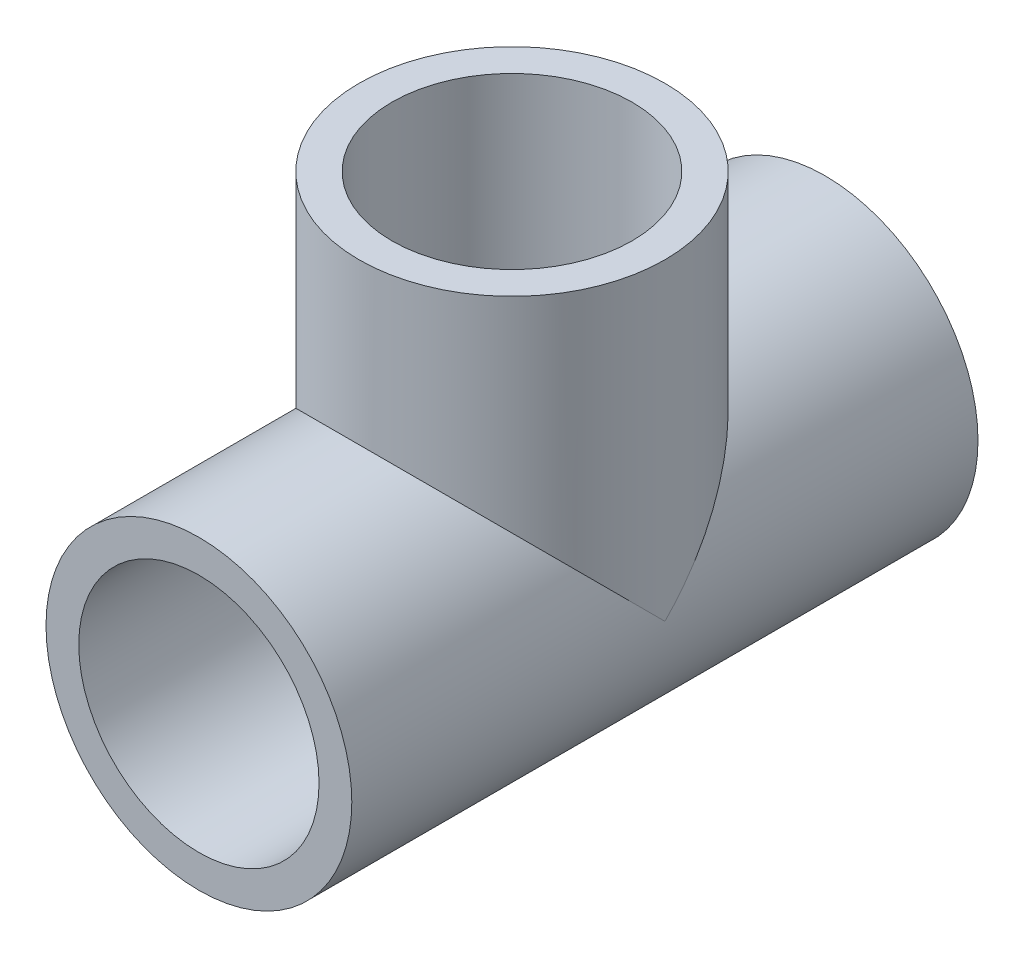
from build123d import *

# Parameters (mm, degrees)
SKETCH1_W          = 16.66875
SKETCH1_H          = 68.2625
SKETCH2_W          = 16.66875
SKETCH2_H          = 34.13125
SKETCH7_R          = 12.7
CUT_EXTRUDE1_DEPTH = 79.11887326
CUT_EXTRUDE2_REACH = 65.431
SKETCH8_R          = 12.7
SKETCH9_R          = 13.096875
CUT_EXTRUDE3_DEPTH = 19.05
CUT_EXTRUDE4_START = -19.05
SKETCH10_R         = 13.096875
CUT_EXTRUDE4_DEPTH = 19.05
SKETCH11_R         = 13.096875
CUT_EXTRUDE5_DEPTH = 19.05


with BuildPart() as part:
    # Sketch1 → Revolve1 (revolve)
    with BuildSketch(Plane(origin=(0, 0, 0), x_dir=(1, 0, 0), z_dir=(0, 1, 0))):
        with Locations((8.334375, 0)):
            Rectangle(SKETCH1_W, SKETCH1_H)
    revolve(axis=Axis((0, 0, 118.243982537), (0, 0, -1)))

    # Sketch2 → Revolve2 (revolve)
    with BuildSketch(Plane.XY):
        with Locations((-8.334375, 17.065625)):
            Rectangle(SKETCH2_W, SKETCH2_H)
    revolve(axis=Axis((0, 0, 0), (0, 1, 0)))

    # Sketch7 → Cut-Extrude1 (cut, through all)
    with BuildSketch(Plane.XY.offset(34.13125)):
        Circle(SKETCH7_R)
    extrude(amount=-CUT_EXTRUDE1_DEPTH, mode=Mode.SUBTRACT)

    # Sketch8 → Cut-Extrude2 (cut, up to next)
    with BuildSketch(Plane(origin=(0, 34.13125, 0), x_dir=(1, 0, 0), z_dir=(0, 1, 0)), mode=Mode.PRIVATE) as cut_extrude2_sk1:
        Circle(SKETCH8_R)
    cut_extrude2_tool1 = extrude(cut_extrude2_sk1.sketch, amount=-CUT_EXTRUDE2_REACH, mode=Mode.PRIVATE) & part.part
    add(cut_extrude2_tool1.solids().sort_by_distance((0, 34.13125, 0))[0], mode=Mode.SUBTRACT)

    # Sketch9 → Cut-Extrude3 (cut)
    with BuildSketch(Plane.XY.offset(34.13125)):
        Circle(SKETCH9_R)
    extrude(amount=-CUT_EXTRUDE3_DEPTH, mode=Mode.SUBTRACT)

    # Sketch10 → Cut-Extrude4 (cut)
    with BuildSketch(Plane(origin=(0, 0, -34.13125), x_dir=(-1, 0, 0), z_dir=(0, 0, -1)).offset(CUT_EXTRUDE4_START)):
        Circle(SKETCH10_R)
    extrude(amount=CUT_EXTRUDE4_DEPTH, mode=Mode.SUBTRACT)

    # Sketch11 → Cut-Extrude5 (cut)
    with BuildSketch(Plane(origin=(0, 34.13125, 0), x_dir=(1, 0, 0), z_dir=(0, 1, 0))):
        Circle(SKETCH11_R)
    extrude(amount=-CUT_EXTRUDE5_DEPTH, mode=Mode.SUBTRACT)


solid = part.part
